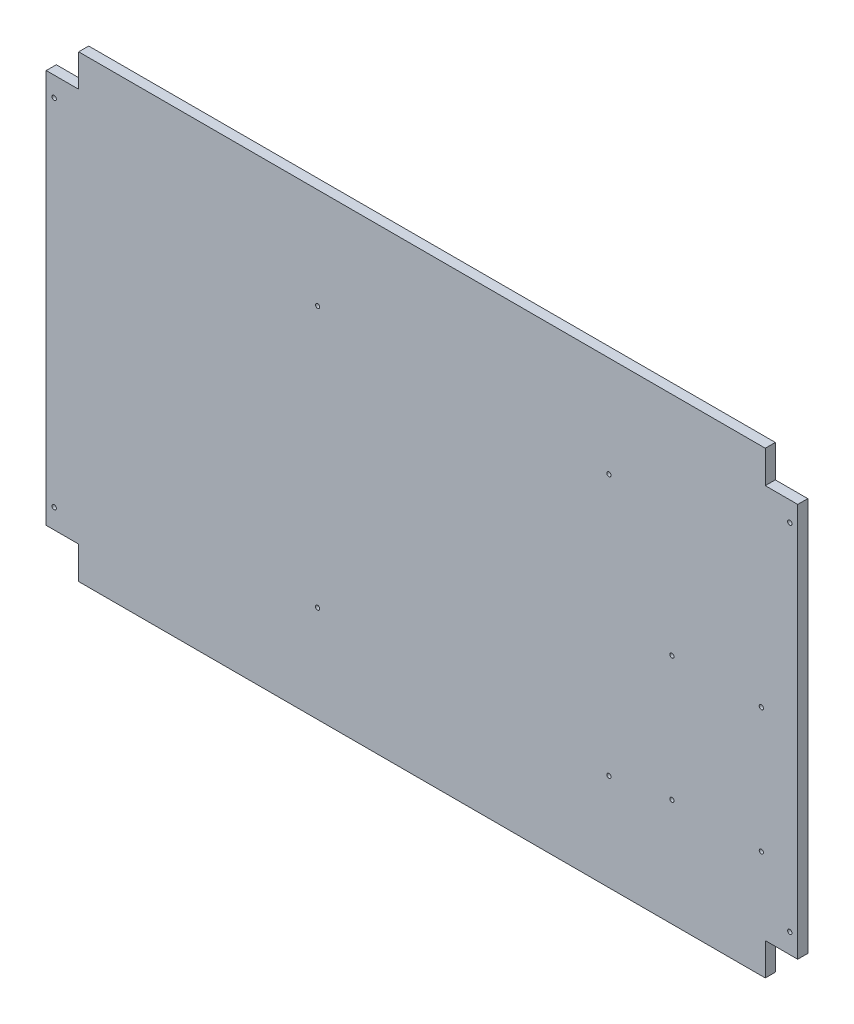
from build123d import *

# Parameters (mm, degrees)
SKETCH2_W           = 950
SKETCH2_H           = 580
BOSS_EXTRUDE1_DEPTH = 12.7
CUT_EXTRUDE1_REACH  = 558.674
SKETCH3_W           = 41
SKETCH3_H           = 41
CUT_EXTRUDE2_REACH  = 558.674
SKETCH4_R           = 2.75
CUT_EXTRUDE3_REACH  = 558.674
SKETCH6_R           = 2.665
CUT_EXTRUDE4_REACH  = 558.674
SKETCH7_R           = 2.665


with BuildPart() as part:
    # Sketch2 → Boss-Extrude1 (new body)
    with BuildSketch(Plane.XY):
        Rectangle(SKETCH2_W, SKETCH2_H)
    extrude(amount=BOSS_EXTRUDE1_DEPTH)

    # Sketch3 → Cut-Extrude1 (cut, up to next)
    with BuildSketch(Plane.XY.offset(12.7), mode=Mode.PRIVATE) as cut_extrude1_sk1:
        with Locations((-454.5, 269.5)):
            Rectangle(SKETCH3_W, SKETCH3_H)
    cut_extrude1_tool1 = extrude(cut_extrude1_sk1.sketch, amount=-CUT_EXTRUDE1_REACH, mode=Mode.PRIVATE) & part.part
    # Sketch3 → Cut-Extrude1 (cut, up to next)
    with BuildSketch(Plane.XY.offset(12.7), mode=Mode.PRIVATE) as cut_extrude1_sk2:
        with Locations((454.5, 269.5)):
            Rectangle(SKETCH3_W, SKETCH3_H)
    cut_extrude1_tool2 = extrude(cut_extrude1_sk2.sketch, amount=-CUT_EXTRUDE1_REACH, mode=Mode.PRIVATE) & part.part
    # Sketch3 → Cut-Extrude1 (cut, up to next)
    with BuildSketch(Plane.XY.offset(12.7), mode=Mode.PRIVATE) as cut_extrude1_sk3:
        with Locations((454.5, -269.5)):
            Rectangle(SKETCH3_W, SKETCH3_H)
    cut_extrude1_tool3 = extrude(cut_extrude1_sk3.sketch, amount=-CUT_EXTRUDE1_REACH, mode=Mode.PRIVATE) & part.part
    # Sketch3 → Cut-Extrude1 (cut, up to next)
    with BuildSketch(Plane.XY.offset(12.7), mode=Mode.PRIVATE) as cut_extrude1_sk4:
        with Locations((-454.5, -269.5)):
            Rectangle(SKETCH3_W, SKETCH3_H)
    cut_extrude1_tool4 = extrude(cut_extrude1_sk4.sketch, amount=-CUT_EXTRUDE1_REACH, mode=Mode.PRIVATE) & part.part
    add(cut_extrude1_tool1.solids().sort_by_distance((-454.5, 269.5, 12.7))[0], mode=Mode.SUBTRACT)
    add(cut_extrude1_tool2.solids().sort_by_distance((454.5, 269.5, 12.7))[0], mode=Mode.SUBTRACT)
    add(cut_extrude1_tool3.solids().sort_by_distance((454.5, -269.5, 12.7))[0], mode=Mode.SUBTRACT)
    add(cut_extrude1_tool4.solids().sort_by_distance((-454.5, -269.5, 12.7))[0], mode=Mode.SUBTRACT)

    # Sketch4 → Cut-Extrude2 (cut, up to next)
    with BuildSketch(Plane.XY.offset(12.7), mode=Mode.PRIVATE) as cut_extrude2_sk1:
        with Locations((-465, -224)):
            Circle(SKETCH4_R)
    cut_extrude2_tool1 = extrude(cut_extrude2_sk1.sketch, amount=-CUT_EXTRUDE2_REACH, mode=Mode.PRIVATE) & part.part
    # Sketch4 → Cut-Extrude2 (cut, up to next)
    with BuildSketch(Plane.XY.offset(12.7), mode=Mode.PRIVATE) as cut_extrude2_sk2:
        with Locations((-465, 224)):
            Circle(SKETCH4_R)
    cut_extrude2_tool2 = extrude(cut_extrude2_sk2.sketch, amount=-CUT_EXTRUDE2_REACH, mode=Mode.PRIVATE) & part.part
    # Sketch4 → Cut-Extrude2 (cut, up to next)
    with BuildSketch(Plane.XY.offset(12.7), mode=Mode.PRIVATE) as cut_extrude2_sk3:
        with Locations((465, -224)):
            Circle(SKETCH4_R)
    cut_extrude2_tool3 = extrude(cut_extrude2_sk3.sketch, amount=-CUT_EXTRUDE2_REACH, mode=Mode.PRIVATE) & part.part
    # Sketch4 → Cut-Extrude2 (cut, up to next)
    with BuildSketch(Plane.XY.offset(12.7), mode=Mode.PRIVATE) as cut_extrude2_sk4:
        with Locations((465, 224)):
            Circle(SKETCH4_R)
    cut_extrude2_tool4 = extrude(cut_extrude2_sk4.sketch, amount=-CUT_EXTRUDE2_REACH, mode=Mode.PRIVATE) & part.part
    add(cut_extrude2_tool1.solids().sort_by_distance((-465, -224, 12.7))[0], mode=Mode.SUBTRACT)
    add(cut_extrude2_tool2.solids().sort_by_distance((-465, 224, 12.7))[0], mode=Mode.SUBTRACT)
    add(cut_extrude2_tool3.solids().sort_by_distance((465, -224, 12.7))[0], mode=Mode.SUBTRACT)
    add(cut_extrude2_tool4.solids().sort_by_distance((465, 224, 12.7))[0], mode=Mode.SUBTRACT)

    # Sketch6 → Cut-Extrude3 (cut, up to next)
    with BuildSketch(Plane.XY.offset(12.7), mode=Mode.PRIVATE) as cut_extrude3_sk1:
        with Locations((-131.973398032, -167.519449166)):
            Circle(SKETCH6_R)
    cut_extrude3_tool1 = extrude(cut_extrude3_sk1.sketch, amount=-CUT_EXTRUDE3_REACH, mode=Mode.PRIVATE) & part.part
    # Sketch6 → Cut-Extrude3 (cut, up to next)
    with BuildSketch(Plane.XY.offset(12.7), mode=Mode.PRIVATE) as cut_extrude3_sk2:
        with Locations((236.326601968, -167.519449166)):
            Circle(SKETCH6_R)
    cut_extrude3_tool2 = extrude(cut_extrude3_sk2.sketch, amount=-CUT_EXTRUDE3_REACH, mode=Mode.PRIVATE) & part.part
    # Sketch6 → Cut-Extrude3 (cut, up to next)
    with BuildSketch(Plane.XY.offset(12.7), mode=Mode.PRIVATE) as cut_extrude3_sk3:
        with Locations((236.326601968, 162.680550834)):
            Circle(SKETCH6_R)
    cut_extrude3_tool3 = extrude(cut_extrude3_sk3.sketch, amount=-CUT_EXTRUDE3_REACH, mode=Mode.PRIVATE) & part.part
    # Sketch6 → Cut-Extrude3 (cut, up to next)
    with BuildSketch(Plane.XY.offset(12.7), mode=Mode.PRIVATE) as cut_extrude3_sk4:
        with Locations((-131.973398032, 162.680550834)):
            Circle(SKETCH6_R)
    cut_extrude3_tool4 = extrude(cut_extrude3_sk4.sketch, amount=-CUT_EXTRUDE3_REACH, mode=Mode.PRIVATE) & part.part
    add(cut_extrude3_tool1.solids().sort_by_distance((-131.973398, -167.519449, 12.7))[0], mode=Mode.SUBTRACT)
    add(cut_extrude3_tool2.solids().sort_by_distance((236.326602, -167.519449, 12.7))[0], mode=Mode.SUBTRACT)
    add(cut_extrude3_tool3.solids().sort_by_distance((236.326602, 162.680551, 12.7))[0], mode=Mode.SUBTRACT)
    add(cut_extrude3_tool4.solids().sort_by_distance((-131.973398, 162.680551, 12.7))[0], mode=Mode.SUBTRACT)

    # Sketch7 → Cut-Extrude4 (cut, up to next)
    with BuildSketch(Plane.XY.offset(12.7), mode=Mode.PRIVATE) as cut_extrude4_sk1:
        with Locations((429, 4)):
            Circle(SKETCH7_R)
    cut_extrude4_tool1 = extrude(cut_extrude4_sk1.sketch, amount=-CUT_EXTRUDE4_REACH, mode=Mode.PRIVATE) & part.part
    # Sketch7 → Cut-Extrude4 (cut, up to next)
    with BuildSketch(Plane.XY.offset(12.7), mode=Mode.PRIVATE) as cut_extrude4_sk2:
        with Locations((429, -154)):
            Circle(SKETCH7_R)
    cut_extrude4_tool2 = extrude(cut_extrude4_sk2.sketch, amount=-CUT_EXTRUDE4_REACH, mode=Mode.PRIVATE) & part.part
    # Sketch7 → Cut-Extrude4 (cut, up to next)
    with BuildSketch(Plane.XY.offset(12.7), mode=Mode.PRIVATE) as cut_extrude4_sk3:
        with Locations((316, 4)):
            Circle(SKETCH7_R)
    cut_extrude4_tool3 = extrude(cut_extrude4_sk3.sketch, amount=-CUT_EXTRUDE4_REACH, mode=Mode.PRIVATE) & part.part
    # Sketch7 → Cut-Extrude4 (cut, up to next)
    with BuildSketch(Plane.XY.offset(12.7), mode=Mode.PRIVATE) as cut_extrude4_sk4:
        with Locations((316, -154)):
            Circle(SKETCH7_R)
    cut_extrude4_tool4 = extrude(cut_extrude4_sk4.sketch, amount=-CUT_EXTRUDE4_REACH, mode=Mode.PRIVATE) & part.part
    add(cut_extrude4_tool1.solids().sort_by_distance((429, 4, 12.7))[0], mode=Mode.SUBTRACT)
    add(cut_extrude4_tool2.solids().sort_by_distance((429, -154, 12.7))[0], mode=Mode.SUBTRACT)
    add(cut_extrude4_tool3.solids().sort_by_distance((316, 4, 12.7))[0], mode=Mode.SUBTRACT)
    add(cut_extrude4_tool4.solids().sort_by_distance((316, -154, 12.7))[0], mode=Mode.SUBTRACT)


solid = part.part
